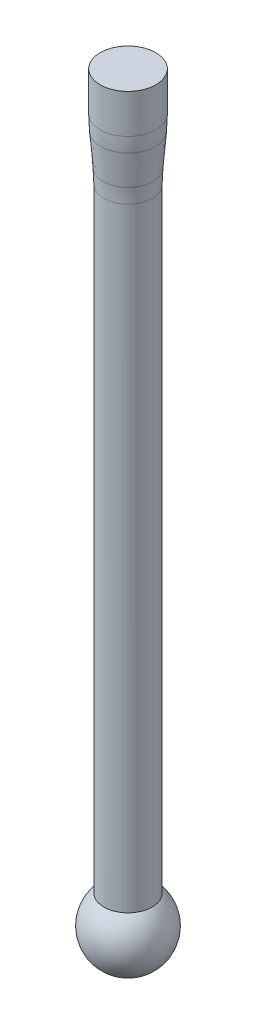
from build123d import *

# Parameters (mm, degrees)
FILLET1_R = 10


with BuildPart() as part:
    # Sketch1 → Revolve1 (revolve)
    with BuildSketch(Plane.XY):
        with BuildLine():
            Line((0, 0), (1.5, 0))
            Line((1.5, 0), (1.5, -2.5))
            Line((1.5, -2.5), (1.3, -5))
            Line((1.3, -5), (1.3, -38.480131585))
            ThreePointArc((1.3, -38.480131585), (1.876131236, -40.69291528), (0, -42))
            Line((0, -42), (0, 0))
        make_face()
    revolve(axis=Axis((0, -119.770062165, 0), (0, 1, 0)))

    # Fillet1
    # the kernel refuses this fillet: 10 mm, written as the material it adds along each edge
    with BuildSketch(Plane(origin=(0, -5, 0), x_dir=(1, 0, 0), z_dir=(0, 0, 1))) as fillet1_piece_1:
        with BuildLine():
            CenterArc((1.3 + FILLET1_R, -FILLET1_R * 0.0399362039845), FILLET1_R, 175.42607874, 4.57392126)
            Line((1.3, -FILLET1_R * 0.0399362039845), (1.3, 0))
            Line((1.3, 0), (1.3 + FILLET1_R * 0.00318472146388, FILLET1_R * 0.0398090182984))
        make_face()
    revolve(axis=Axis((0, -5, 0), (0, 1, 0)))
    # the kernel refuses this fillet: 10 mm, written as the material it takes off along each edge
    with BuildSketch(Plane(origin=(0, -2.5, 0), x_dir=(1, 0, 0), z_dir=(0, 0, 1))) as fillet1_2_piece_1:
        with BuildLine():
            CenterArc((1.5 - FILLET1_R, FILLET1_R * 0.0399362039845), FILLET1_R, 355.42607874, 4.57392126)
            Line((1.5 - FILLET1_R * 0.00318472146387, -FILLET1_R * 0.0398090182984), (1.5, 0))
            Line((1.5, 0), (1.5, FILLET1_R * 0.0399362039845))
        make_face()
    revolve(axis=Axis((0, -2.5, 0), (0, 1, 0)), mode=Mode.SUBTRACT)


solid = part.part
